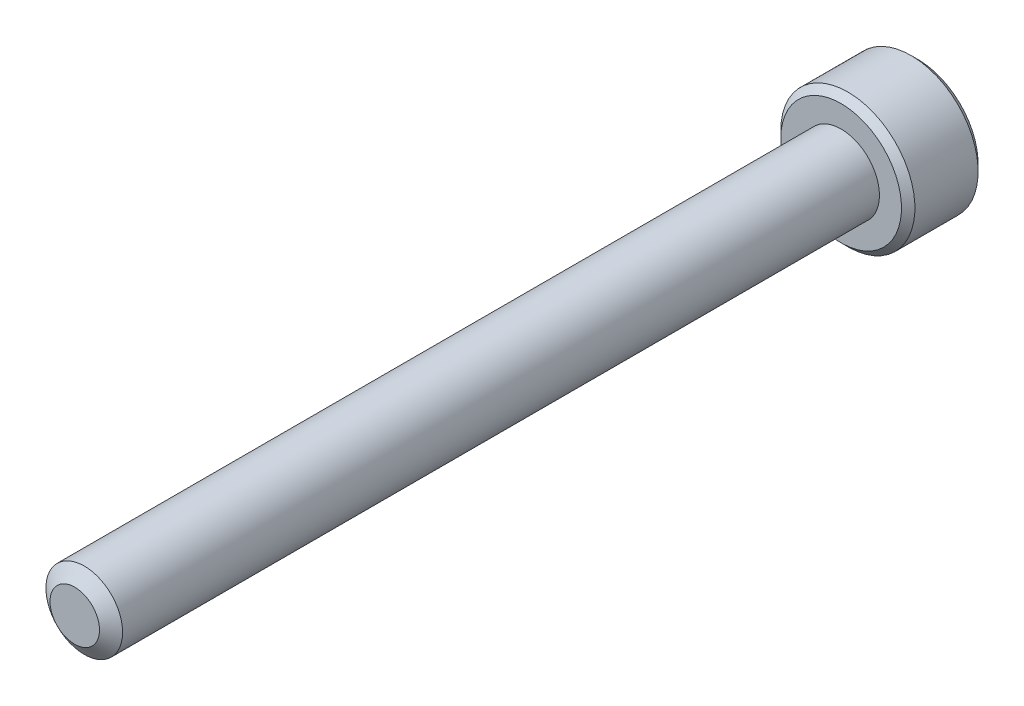
from build123d import *

# Parameters (mm, degrees)
SKETCH1_R          = 2
EXTRUDE1_DEPTH     = 40
SKETCH6_R          = 3.5
EXTRUDE2_DEPTH     = 4
CUT_EXTRUDE1_DEPTH = 2.25
CHAMFER1_SIZE      = 0.35


with BuildPart() as part:
    # Sketch1 → Extrude1 (new body)
    with BuildSketch(Plane.XY):
        Circle(SKETCH1_R)
    extrude(amount=-EXTRUDE1_DEPTH)

    # Sketch4 → Cut-Revolve1 (revolve, cut)
    with BuildSketch(Plane(origin=(0, 0, 0), x_dir=(0, 0, -1), z_dir=(1, 0, 0))):
        Polygon((0.496211411, 2), (0, 1.291336663), (0, 2), align=None)
    revolve(axis=Axis((0, 0, 0), (0, 0, -1)), mode=Mode.SUBTRACT)

    # Sketch6 → Extrude2 (add)
    with BuildSketch(Plane(origin=(0, 0, -40), x_dir=(-1, 0, 0), z_dir=(0, 0, -1))):
        Circle(SKETCH6_R)
    extrude(amount=EXTRUDE2_DEPTH)

    # Sketch7 → Cut-Extrude1 (cut)
    with BuildSketch(Plane(origin=(0, 0, -44), x_dir=(-1, 0, 0), z_dir=(0, 0, -1))):
        Polygon((0, 1.732050808), (-1.5, 0.866025404), (-1.5, -0.866025404), (0, -1.732050808), (1.5, -0.866025404), (1.5, 0.866025404), align=None)
    extrude(amount=-CUT_EXTRUDE1_DEPTH, mode=Mode.SUBTRACT)

    # Cut-Extrude2 cone 1 section (through the dimple's axis) → Cut-Extrude2 (revolve, cut)
    with BuildSketch(Plane(origin=(0, 0, -44), x_dir=(0, 1, 0), z_dir=(1, 0, 0))):
        Polygon((0, 0), (1.732050808, 0), (0, 1.732050808), align=None)
    revolve(axis=Axis((0, 0, -44), (0, 0, 1)), mode=Mode.SUBTRACT)

    # Chamfer1
    chamfer1_edges = [part.edges().sort_by_distance(p)[0] for p in [
        (3.5, 0, -44),
        (3.5, 0, -40),
    ]]
    chamfer(chamfer1_edges, length=CHAMFER1_SIZE)


solid = part.part
